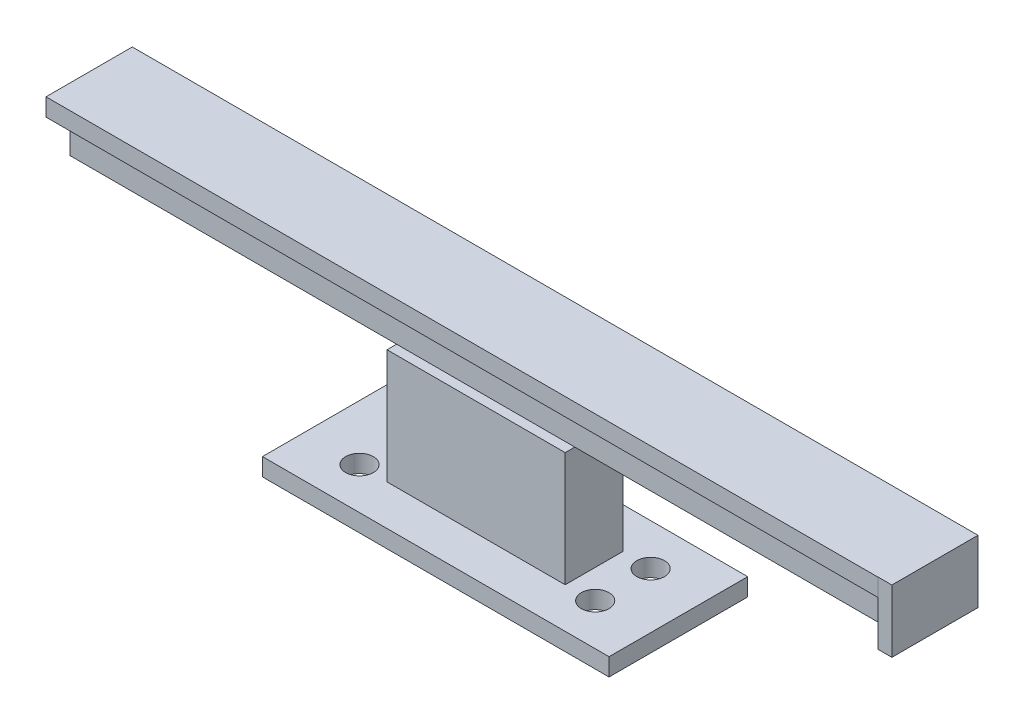
from build123d import *

# Parameters (mm, degrees)
SKETCH1_W           = 50
SKETCH1_H           = 20
SKETCH1_R           = 2
BOSS_EXTRUDE1_DEPTH = 2.54
SKETCH2_W           = 25.697892262
SKETCH2_H           = 8.354695914
BOSS_EXTRUDE2_DEPTH = 16.51
SKETCH3_W           = 120
SKETCH3_H           = 5.588
BOSS_EXTRUDE3_DEPTH = 6.51
SKETCH4_W           = 120
SKETCH4_H           = 12.446
BOSS_EXTRUDE4_DEPTH = 2.54
SKETCH6_W           = 12.425038184
SKETCH6_H           = 9.042273223
BOSS_EXTRUDE6_DEPTH = 2


with BuildPart() as part:
    # Sketch1 → Boss-Extrude1 (new body)
    with BuildSketch(Plane(origin=(0, 0, 0), x_dir=(1, 0, 0), z_dir=(0, 1, 0))):
        with Locations((0, -2.5)):
            Rectangle(SKETCH1_W, SKETCH1_H)
        with Locations((-17, -6.5)):
            Circle(SKETCH1_R, mode=Mode.SUBTRACT)
        with Locations((17, -6.5)):
            Circle(SKETCH1_R, mode=Mode.SUBTRACT)
        with Locations((-17, 1.5)):
            Circle(SKETCH1_R, mode=Mode.SUBTRACT)
        with Locations((17, 1.5)):
            Circle(SKETCH1_R, mode=Mode.SUBTRACT)
    extrude(amount=BOSS_EXTRUDE1_DEPTH)

    # Sketch2 → Boss-Extrude2 (add)
    with BuildSketch(Plane(origin=(0, 2.54, 0), x_dir=(1, 0, 0), z_dir=(0, 1, 0))):
        with Locations((0, -2.5)):
            Rectangle(SKETCH2_W, SKETCH2_H)
    extrude(amount=BOSS_EXTRUDE2_DEPTH)

    # Sketch3 → Boss-Extrude3 (add)
    with BuildSketch(Plane(origin=(0, 19.05, 0), x_dir=(1, 0, 0), z_dir=(0, 1, 0))):
        with Locations((0, -2.5)):
            Rectangle(SKETCH3_W, SKETCH3_H)
    extrude(amount=BOSS_EXTRUDE3_DEPTH)

    # Sketch4 → Boss-Extrude4 (add)
    with BuildSketch(Plane(origin=(0, 25.56, 0), x_dir=(1, 0, 0), z_dir=(0, 1, 0))):
        with Locations((0, -2.5)):
            Rectangle(SKETCH4_W, SKETCH4_H)
    extrude(amount=BOSS_EXTRUDE4_DEPTH)

    # Sketch6 → Boss-Extrude6 (add)
    with BuildSketch(Plane(origin=(60, 0, 0), x_dir=(0, 0, -1), z_dir=(1, 0, 0))):
        with Locations((-2.489519092, 23.578863389)):
            Rectangle(SKETCH6_W, SKETCH6_H)
    extrude(amount=BOSS_EXTRUDE6_DEPTH)


solid = part.part
